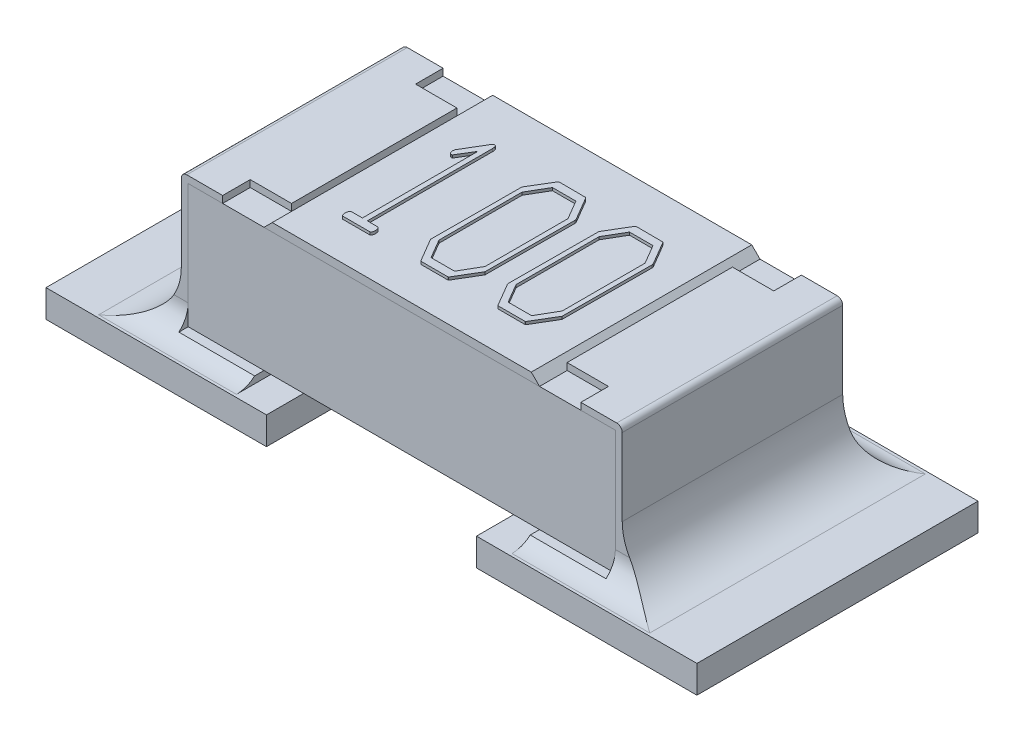
from build123d import *

# Parameters (mm, degrees)
SKETCH1_W             = 0.8
SKETCH1_H             = 0.45
BOSS_EXTRUDE1_DEPTH   = 0.775
BOSS_EXTRUDE2_DEPTH   = 0.4
BOSS_EXTRUDE2_2_DEPTH = 0.4
SKETCH3_W             = 0.15
SKETCH3_H             = 0.1
CUT_EXTRUDE1_DEPTH    = 0.025
BOSS_EXTRUDE3_DEPTH   = 0.4
BOSS_EXTRUDE4_DEPTH   = 0.01
SKETCH7_W             = 0.8
SKETCH7_H             = 1.02
BOSS_EXTRUDE5_DEPTH   = 0.1
FILLET3_R             = 0.2
FILLET4_R             = 0.2
FILLET5_R             = 0.1
FILLET6_R             = 0.1


with BuildPart() as part:
    # Sketch1 → Boss-Extrude1 (new, symmetric)
    with BuildSketch(Plane(origin=(0, 0, 0), x_dir=(0, 0, -1), z_dir=(1, 0, 0))):
        with Locations((0, 0.35)):
            Rectangle(SKETCH1_W, SKETCH1_H)
    extrude(amount=BOSS_EXTRUDE1_DEPTH, both=True)


with BuildPart() as body_2:
    # Sketch2 → Boss-Extrude2 (new, symmetric)
    with BuildSketch(Plane.XY):
        with BuildLine():
            Line((-0.5, 0.6), (-0.78, 0.6))
            ThreePointArc((-0.78, 0.6), (-0.794142136, 0.594142136), (-0.8, 0.58))
            Line((-0.8, 0.58), (-0.8, 0.1))
            Line((-0.8, 0.1), (-0.5, 0.1))
            Line((-0.5, 0.1), (-0.5, 0.125))
            Line((-0.5, 0.125), (-0.775, 0.125))
            Line((-0.775, 0.125), (-0.775, 0.575))
            Line((-0.775, 0.575), (-0.5, 0.575))
            Line((-0.5, 0.575), (-0.5, 0.6))
        make_face()
    extrude(amount=BOSS_EXTRUDE2_DEPTH, both=True)


with BuildPart() as body_3:
    # Sketch2 → Boss-Extrude2 2 (new, symmetric)
    with BuildSketch(Plane.XY):
        with BuildLine():
            Line((0.5, 0.575), (0.5, 0.6))
            Line((0.5, 0.6), (0.78, 0.6))
            ThreePointArc((0.78, 0.6), (0.794142136, 0.594142136), (0.8, 0.58))
            Line((0.8, 0.58), (0.8, 0.1))
            Line((0.8, 0.1), (0.5, 0.1))
            Line((0.5, 0.1), (0.5, 0.125))
            Line((0.5, 0.125), (0.775, 0.125))
            Line((0.775, 0.125), (0.775, 0.575))
            Line((0.775, 0.575), (0.5, 0.575))
        make_face()
    extrude(amount=BOSS_EXTRUDE2_2_DEPTH, both=True)


with BuildPart() as cut_extrude1_tool:
    # Sketch3 → Cut-Extrude1 (new body)
    with BuildSketch(Plane(origin=(0, 0.6, 0), x_dir=(1, 0, 0), z_dir=(0, 1, 0))):
        with Locations((-0.575, 0.35)):
            Rectangle(SKETCH3_W, SKETCH3_H)
        with Locations((-0.575, -0.35)):
            Rectangle(SKETCH3_W, SKETCH3_H)
        with Locations((0.575, -0.35)):
            Rectangle(SKETCH3_W, SKETCH3_H)
        with Locations((0.575, 0.35)):
            Rectangle(SKETCH3_W, SKETCH3_H)
    extrude(amount=-CUT_EXTRUDE1_DEPTH)


with BuildPart() as body_2_1:
    add(body_2.part)

    # Cut-Extrude1: cut by cut_extrude1_tool
    add(cut_extrude1_tool.part, mode=Mode.SUBTRACT)



with BuildPart() as body_3_1:
    add(body_3.part)

    # Cut-Extrude1: cut by cut_extrude1_tool
    add(cut_extrude1_tool.part, mode=Mode.SUBTRACT)


with BuildPart() as body_4:
    # Sketch4 → Boss-Extrude3 (new, symmetric)
    with BuildSketch(Plane.XY):
        Polygon((-0.5, 0.575), (0.5, 0.575), (0.47, 0.605), (-0.47, 0.605), align=None)
    extrude(amount=BOSS_EXTRUDE3_DEPTH, both=True)

    # Sketch6 → Boss-Extrude4 (add)
    # profile 1 of 3: a face of its own
    with BuildSketch(Plane(origin=(0, 0.605, 0), x_dir=(1, 0, 0), z_dir=(0, 1, 0))):
        with BuildLine():
            Line((-0.292857143, 0.221819196), (-0.292857143, -0.232142857))
            Line((-0.292857143, -0.232142857), (-0.253608631, -0.232142857))
            add(Edge.make_bspline(
                [(-0.253608631, -0.232142857), (-0.252514915, -0.233159523), (-0.250346122, -0.235175528), (-0.248921239, -0.239323698), (-0.247952001, -0.243100354), (-0.24781151, -0.245561302), (-0.247749256, -0.246651786)],
                knots=[0, 0, 0, 0, 1.094507773, 2.170363376, 3.18925981, 4, 4, 4, 4], degree=3))
            add(Edge.make_bspline(
                [(-0.247749256, -0.246651786), (-0.247790011, -0.24890061), (-0.247860511, -0.252790757), (-0.248927629, -0.257670974), (-0.250957131, -0.261266063), (-0.253164339, -0.261705298), (-0.254166667, -0.261904762)],
                knots=[0, 0, 0, 0, 1.483935822, 2.566997854, 3.349251094, 4, 4, 4, 4], degree=3))
            Line((-0.254166667, -0.261904762), (-0.352287946, -0.261904762))
            add(Edge.make_bspline(
                [(-0.352287946, -0.261904762), (-0.353191845, -0.261383497), (-0.355138277, -0.260261018), (-0.356845026, -0.256793507), (-0.357784968, -0.252323852), (-0.357898096, -0.248923727), (-0.35796131, -0.24702381)],
                knots=[0, 0, 0, 0, 0.731657516, 1.575533429, 2.645259425, 4, 4, 4, 4], degree=3))
            add(Edge.make_bspline(
                [(-0.35796131, -0.24702381), (-0.357847061, -0.245999991), (-0.357543408, -0.24327885), (-0.356855684, -0.239634421), (-0.355750939, -0.236384481), (-0.354715358, -0.234196716), (-0.35312544, -0.232808963), (-0.351931893, -0.232359173), (-0.351357887, -0.232142857)],
                knots=[0, 0, 0, 0, 1.077846596, 2.864738214, 3.859388994, 4.671949365, 5.361307703, 6, 6, 6, 6], degree=3))
            Line((-0.351357887, -0.232142857), (-0.310714286, -0.232142857))
            Line((-0.310714286, -0.232142857), (-0.310714286, 0.186476935))
            Line((-0.310714286, 0.186476935), (-0.345219494, 0.130208333))
            add(Edge.make_bspline(
                [(-0.345219494, 0.130208333), (-0.34594703, 0.129816395), (-0.34723663, 0.129121662), (-0.348681862, 0.128906863), (-0.349311756, 0.128813244)],
                knots=[0, 0, 0, 0, 1.128313794, 2, 2, 2, 2], degree=3))
            add(Edge.make_bspline(
                [(-0.349311756, 0.128813244), (-0.34994165, 0.128906863), (-0.351386882, 0.129121662), (-0.352676481, 0.129816395), (-0.353404018, 0.130208333)],
                knots=[0, 0, 0, 0, 0.871686206, 2, 2, 2, 2], degree=3))
            add(Edge.make_bspline(
                [(-0.353404018, 0.130208333), (-0.354762035, 0.132029405), (-0.357658077, 0.135912935), (-0.35809911, 0.140752164), (-0.358333333, 0.143322173)],
                knots=[0, 0, 0, 0, 0.937843913, 2, 2, 2, 2], degree=3))
            Line((-0.358333333, 0.143322173), (-0.357124256, 0.150297619))
            Line((-0.357124256, 0.150297619), (-0.306901042, 0.234654018))
            add(Edge.make_bspline(
                [(-0.306901042, 0.234654018), (-0.306052725, 0.23565958), (-0.304616067, 0.23736254), (-0.302476074, 0.237882361), (-0.301599702, 0.238095238)],
                knots=[0, 0, 0, 0, 1.180958283, 2, 2, 2, 2], degree=3))
            add(Edge.make_bspline(
                [(-0.301599702, 0.238095238), (-0.300254548, 0.237901979), (-0.297496165, 0.23750568), (-0.29448599, 0.233775342), (-0.293094631, 0.228376002), (-0.292944039, 0.224218313), (-0.292857143, 0.221819196)],
                knots=[0, 0, 0, 0, 0.76869288, 1.576286457, 2.601441333, 4, 4, 4, 4], degree=3))
        make_face()
    # profile 2 of 3: a face of its own
    with BuildSketch(Plane(origin=(0, 0.605, 0), x_dir=(1, 0, 0), z_dir=(0, 1, 0))):
        Polygon((0.032849702, 0.234002976), (0.081305804, 0.151227679), (0.082142857, 0.145182292), (0.080561756, -0.178478423), (0.031268601, -0.26125372), (0.027269345, -0.261904762), (-0.068526786, -0.261904762), (-0.07094494, -0.259207589), (-0.119866071, -0.17578125), (-0.120238095, -0.168991815), (-0.118656994, 0.154668899), (-0.069363839, 0.236700149), (-0.066945685, 0.238095238), (0.030059524, 0.237444196), align=None)
        Polygon((0.064285714, 0.138764881), (0.023549107, 0.208333333), (-0.061644345, 0.208333333), (-0.102380952, 0.138764881), (-0.102380952, -0.162574405), (-0.061644345, -0.232142857), (0.023549107, -0.232142857), (0.064285714, -0.161923363), align=None, mode=Mode.SUBTRACT)
    # profile 3 of 3: a face of its own
    with BuildSketch(Plane(origin=(0, 0.605, 0), x_dir=(1, 0, 0), z_dir=(0, 1, 0))):
        Polygon((0.312611607, 0.234002976), (0.361067708, 0.151227679), (0.361904762, 0.145182292), (0.360323661, -0.178478423), (0.311030506, -0.26125372), (0.30703125, -0.261904762), (0.211235119, -0.261904762), (0.208816964, -0.259207589), (0.159895833, -0.17578125), (0.15952381, -0.168991815), (0.161104911, 0.154668899), (0.210398065, 0.236700149), (0.21281622, 0.238095238), (0.309821429, 0.237444196), align=None)
        Polygon((0.344047619, 0.138764881), (0.303311012, 0.208333333), (0.21811756, 0.208333333), (0.177380952, 0.138764881), (0.177380952, -0.162574405), (0.21811756, -0.232142857), (0.303311012, -0.232142857), (0.344047619, -0.161923363), align=None, mode=Mode.SUBTRACT)
    extrude(amount=BOSS_EXTRUDE4_DEPTH)


with BuildPart() as body_2_2:
    add(body_2_1.part)

    add(body_3_1.part)  # Boss-Extrude5 merges body 3
    # Sketch7 → Boss-Extrude5 (add)
    with BuildSketch(Plane(origin=(0, 0, 0), x_dir=(1, 0, 0), z_dir=(0, 1, 0))):
        with Locations((-0.781, 0)):
            Rectangle(SKETCH7_W, SKETCH7_H)
        with Locations((0.781, 0)):
            Rectangle(SKETCH7_W, SKETCH7_H)
    extrude(amount=BOSS_EXTRUDE5_DEPTH)

    # Fillet3
    fillet3_edges = [body_2_2.edges().sort_by_distance(p)[0] for p in [
        (-0.8, 0.1, 0),
    ]]
    fillet(fillet3_edges, radius=FILLET3_R)

    # Fillet4
    fillet4_edges = [body_2_2.edges().sort_by_distance(p)[0] for p in [
        (0.8, 0.1, 0),
    ]]
    fillet(fillet4_edges, radius=FILLET4_R)

    # Fillet5
    fillet5_edges = [body_2_2.edges().sort_by_distance(p)[0] for p in [
        (0.75, 0.1, 0.4),
    ]]
    fillet(fillet5_edges, radius=FILLET5_R)
    fillet5_2_edges = [body_2_2.edges().sort_by_distance(p)[0] for p in [
        (0.75, 0.1, -0.4),
    ]]
    fillet(fillet5_2_edges, radius=FILLET5_R)

    # Fillet6
    fillet6_edges = [body_2_2.edges().sort_by_distance(p)[0] for p in [
        (-0.75, 0.1, -0.4),
    ]]
    fillet(fillet6_edges, radius=FILLET6_R)
    fillet6_2_edges = [body_2_2.edges().sort_by_distance(p)[0] for p in [
        (-0.75, 0.1, 0.4),
    ]]
    fillet(fillet6_2_edges, radius=FILLET6_R)


solid = Compound([part.part, body_4.part, body_2_2.part])
